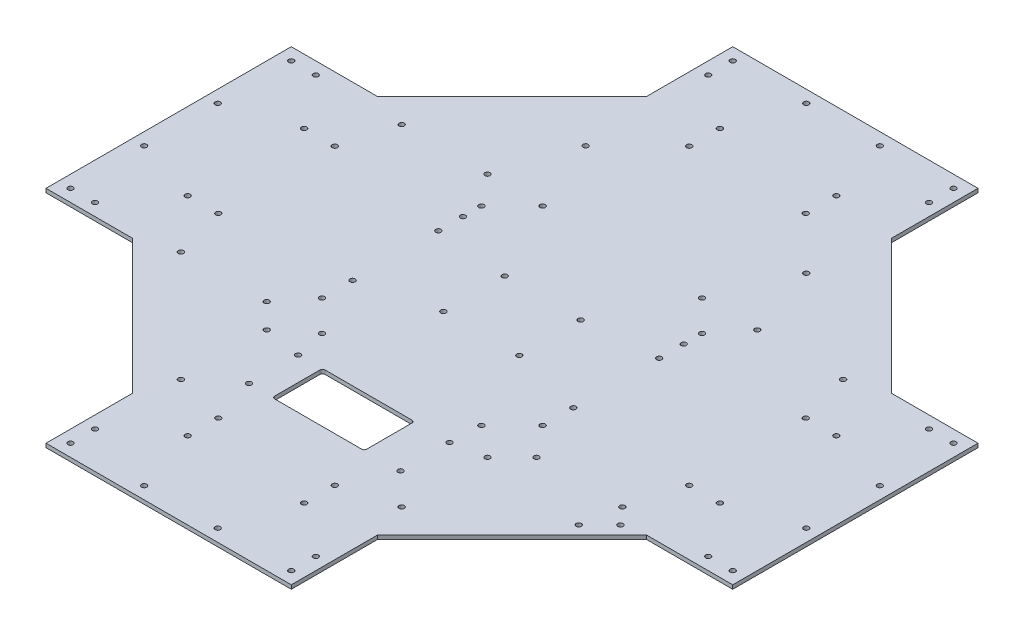
from build123d import *

# Parameters (mm, degrees)
SKETCH1_R           = 2.125
BOSS_EXTRUDE1_DEPTH = 3.175
SKETCH2_R           = 2.125
SKETCH2_W           = 75
SKETCH2_H           = 41
CUT_EXTRUDE1_DEPTH  = 396.992525971
FILLET1_R           = 2


with BuildPart() as part:
    # Sketch1 → Boss-Extrude1 (new body)
    with BuildSketch(Plane(origin=(0, 0, 0), x_dir=(1, 0, 0), z_dir=(0, 1, 0))):
        Polygon((-100, -280), (0, -280), (100, -280), (100, -209.601551084), (209.601551084, -100), (280, -100), (280, 0), (280, 100), (209.601551084, 100), (100, 209.601551084), (100, 280), (0, 280), (-100, 280), (-100, 209.601551084), (-209.601551084, 100), (-280, 100), (-280, 0), (-280, -100), (-209.601551084, -100), (-100, -209.601551084), align=None)
        with Locations((-90, -270)):
            Circle(SKETCH1_R, mode=Mode.SUBTRACT)
        with Locations((-90, -250)):
            Circle(SKETCH1_R, mode=Mode.SUBTRACT)
        with Locations((-30, -270)):
            Circle(SKETCH1_R, mode=Mode.SUBTRACT)
        with Locations((-47.5, -217)):
            Circle(SKETCH1_R, mode=Mode.SUBTRACT)
        with Locations((-90, -180)):
            Circle(SKETCH1_R, mode=Mode.SUBTRACT)
        with Locations((-47.5, -192)):
            Circle(SKETCH1_R, mode=Mode.SUBTRACT)
        with Locations((-270, -90)):
            Circle(SKETCH1_R, mode=Mode.SUBTRACT)
        with Locations((-250, -90)):
            Circle(SKETCH1_R, mode=Mode.SUBTRACT)
        with Locations((-180, -90)):
            Circle(SKETCH1_R, mode=Mode.SUBTRACT)
        with Locations((-217, -47.5)):
            Circle(SKETCH1_R, mode=Mode.SUBTRACT)
        with Locations((-270, -30)):
            Circle(SKETCH1_R, mode=Mode.SUBTRACT)
        with Locations((-192, -47.5)):
            Circle(SKETCH1_R, mode=Mode.SUBTRACT)
        with Locations((-90, -110)):
            Circle(SKETCH1_R, mode=Mode.SUBTRACT)
        with Locations((-110, -90)):
            Circle(SKETCH1_R, mode=Mode.SUBTRACT)
        with Locations((-90, -40)):
            Circle(SKETCH1_R, mode=Mode.SUBTRACT)
        with Locations((30, -270)):
            Circle(SKETCH1_R, mode=Mode.SUBTRACT)
        with Locations((47.5, -217)):
            Circle(SKETCH1_R, mode=Mode.SUBTRACT)
        with Locations((90, -270)):
            Circle(SKETCH1_R, mode=Mode.SUBTRACT)
        with Locations((90, -250)):
            Circle(SKETCH1_R, mode=Mode.SUBTRACT)
        with Locations((47.5, -192)):
            Circle(SKETCH1_R, mode=Mode.SUBTRACT)
        with Locations((90, -180)):
            Circle(SKETCH1_R, mode=Mode.SUBTRACT)
        with Locations((90, -110)):
            Circle(SKETCH1_R, mode=Mode.SUBTRACT)
        with Locations((110, -90)):
            Circle(SKETCH1_R, mode=Mode.SUBTRACT)
        with Locations((90, -40)):
            Circle(SKETCH1_R, mode=Mode.SUBTRACT)
        with Locations((180, -90)):
            Circle(SKETCH1_R, mode=Mode.SUBTRACT)
        with Locations((250, -90)):
            Circle(SKETCH1_R, mode=Mode.SUBTRACT)
        with Locations((270, -90)):
            Circle(SKETCH1_R, mode=Mode.SUBTRACT)
        with Locations((192, -47.5)):
            Circle(SKETCH1_R, mode=Mode.SUBTRACT)
        with Locations((217, -47.5)):
            Circle(SKETCH1_R, mode=Mode.SUBTRACT)
        with Locations((270, -30)):
            Circle(SKETCH1_R, mode=Mode.SUBTRACT)
        with Locations((-270, 30)):
            Circle(SKETCH1_R, mode=Mode.SUBTRACT)
        with Locations((-217, 47.5)):
            Circle(SKETCH1_R, mode=Mode.SUBTRACT)
        with Locations((-192, 47.5)):
            Circle(SKETCH1_R, mode=Mode.SUBTRACT)
        with Locations((-270, 90)):
            Circle(SKETCH1_R, mode=Mode.SUBTRACT)
        with Locations((-250, 90)):
            Circle(SKETCH1_R, mode=Mode.SUBTRACT)
        with Locations((-180, 90)):
            Circle(SKETCH1_R, mode=Mode.SUBTRACT)
        with Locations((-90, 30)):
            Circle(SKETCH1_R, mode=Mode.SUBTRACT)
        with Locations((-90, 50)):
            Circle(SKETCH1_R, mode=Mode.SUBTRACT)
        with Locations((-110, 90)):
            Circle(SKETCH1_R, mode=Mode.SUBTRACT)
        with Locations((-90, 150)):
            Circle(SKETCH1_R, mode=Mode.SUBTRACT)
        with Locations((-47.5, 192)):
            Circle(SKETCH1_R, mode=Mode.SUBTRACT)
        with Locations((-90, 250)):
            Circle(SKETCH1_R, mode=Mode.SUBTRACT)
        with Locations((-90, 270)):
            Circle(SKETCH1_R, mode=Mode.SUBTRACT)
        with Locations((-47.5, 217)):
            Circle(SKETCH1_R, mode=Mode.SUBTRACT)
        with Locations((-30, 270)):
            Circle(SKETCH1_R, mode=Mode.SUBTRACT)
        with Locations((90, 30)):
            Circle(SKETCH1_R, mode=Mode.SUBTRACT)
        with Locations((90, 50)):
            Circle(SKETCH1_R, mode=Mode.SUBTRACT)
        with Locations((110, 90)):
            Circle(SKETCH1_R, mode=Mode.SUBTRACT)
        with Locations((192, 47.5)):
            Circle(SKETCH1_R, mode=Mode.SUBTRACT)
        with Locations((270, 30)):
            Circle(SKETCH1_R, mode=Mode.SUBTRACT)
        with Locations((217, 47.5)):
            Circle(SKETCH1_R, mode=Mode.SUBTRACT)
        with Locations((180, 90)):
            Circle(SKETCH1_R, mode=Mode.SUBTRACT)
        with Locations((250, 90)):
            Circle(SKETCH1_R, mode=Mode.SUBTRACT)
        with Locations((270, 90)):
            Circle(SKETCH1_R, mode=Mode.SUBTRACT)
        with Locations((47.5, 192)):
            Circle(SKETCH1_R, mode=Mode.SUBTRACT)
        with Locations((90, 150)):
            Circle(SKETCH1_R, mode=Mode.SUBTRACT)
        with Locations((47.5, 217)):
            Circle(SKETCH1_R, mode=Mode.SUBTRACT)
        with Locations((30, 270)):
            Circle(SKETCH1_R, mode=Mode.SUBTRACT)
        with Locations((90, 250)):
            Circle(SKETCH1_R, mode=Mode.SUBTRACT)
        with Locations((90, 270)):
            Circle(SKETCH1_R, mode=Mode.SUBTRACT)
    extrude(amount=BOSS_EXTRUDE1_DEPTH)

    # Sketch2 → Cut-Extrude1 (cut, through all)
    with BuildSketch(Plane(origin=(0, 3.175, 0), x_dir=(1, 0, 0), z_dir=(0, 1, 0))):
        with Locations((-31, 25)):
            Circle(SKETCH2_R)
        with Locations((-31, -25)):
            Circle(SKETCH2_R)
        with Locations((31, -25)):
            Circle(SKETCH2_R)
        with Locations((31, 25)):
            Circle(SKETCH2_R)
        with Locations((-90, 65)):
            Circle(SKETCH2_R)
        with Locations((-65, 90)):
            Circle(SKETCH2_R)
        with Locations((65, 90)):
            Circle(SKETCH2_R)
        with Locations((90, 65)):
            Circle(SKETCH2_R)
        with Locations((90, -65)):
            Circle(SKETCH2_R)
        with Locations((65, -90)):
            Circle(SKETCH2_R)
        with Locations((-65, -90)):
            Circle(SKETCH2_R)
        with Locations((-90, -65)):
            Circle(SKETCH2_R)
        with Locations((64.065141092, -115)):
            Circle(SKETCH2_R)
        with Locations((64.065141092, -155)):
            Circle(SKETCH2_R)
        with Locations((-59.434858908, -115)):
            Circle(SKETCH2_R)
        with Locations((-59.434858908, -155)):
            Circle(SKETCH2_R)
        with Locations((174.953318806, -120.506096654)):
            Circle(SKETCH2_R)
        with Locations((191.923881554, -103.535533906)):
            Circle(SKETCH2_R)
        with Locations((-2.534858908, -135)):
            Rectangle(SKETCH2_W, SKETCH2_H)
    extrude(amount=-CUT_EXTRUDE1_DEPTH, mode=Mode.SUBTRACT)

    # Fillet1
    fillet1_edges = [part.edges().sort_by_distance(p)[0] for p in [
        (34.965141092, 1.5875, 114.5),
        (34.965141092, 1.5875, 155.5),
        (-40.034858908, 1.5875, 155.5),
        (-40.034858908, 1.5875, 114.5),
    ]]
    fillet(fillet1_edges, radius=FILLET1_R)


solid = part.part
